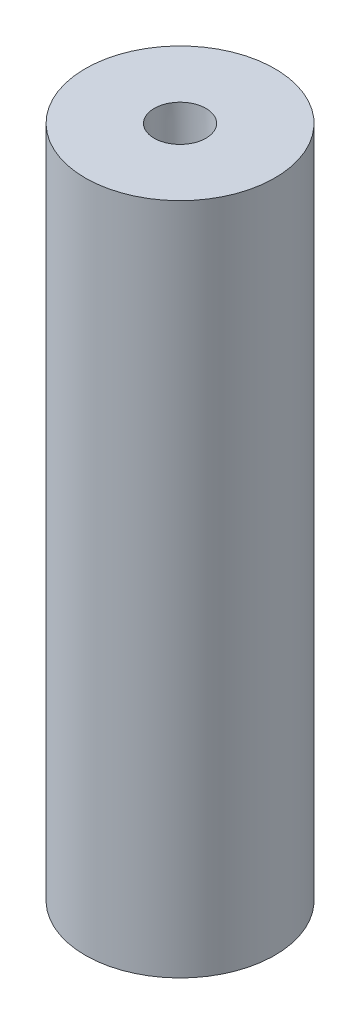
from build123d import *

# Parameters (mm, degrees)
SKETCH1_R           = 9.15
BOSS_EXTRUDE1_DEPTH = 65
SKETCH2_R           = 2.5
CUT_EXTRUDE1_DEPTH  = 10
CHAMFER1_SIZE2      = 0.25
CHAMFER1_SIZE       = 10
CUT_EXTRUDE2_START  = -10
SKETCH3_R           = 2.5
CUT_EXTRUDE2_DEPTH  = 10
CHAMFER2_SIZE2      = 0.25
CHAMFER2_SIZE       = 10


with BuildPart() as part:
    # Sketch1 → Boss-Extrude1 (new body)
    with BuildSketch(Plane(origin=(0, 0, 0), x_dir=(1, 0, 0), z_dir=(0, 1, 0))):
        with Locations(Location((0, 0, 0), (0, 0, 270))):
            Circle(SKETCH1_R)
    extrude(amount=BOSS_EXTRUDE1_DEPTH)

    # Sketch2 → Cut-Extrude1 (cut)
    with BuildSketch(Plane(origin=(0, 65, 0), x_dir=(1, 0, 0), z_dir=(0, 1, 0))):
        with Locations(Location((0, 0, 0), (0, 0, 270))):
            Circle(SKETCH2_R)
    extrude(amount=-CUT_EXTRUDE1_DEPTH, mode=Mode.SUBTRACT)

    # Chamfer1
    chamfer1_edges = [part.edges().sort_by_distance(p)[0] for p in [
        (0, 55, -2.5),
    ]]
    chamfer1_side = [part.faces().sort_by_distance(p)[0] for p in [
        (0, 55.005, -2.5),
    ]]
    chamfer(chamfer1_edges, length=CHAMFER1_SIZE - 0.0001, length2=CHAMFER1_SIZE2 - 0.0001, reference=chamfer1_side[0])  # a hair under: the kernel refuses the full size

    # Sketch3 → Cut-Extrude2 (cut)
    with BuildSketch(Plane.XZ.offset(CUT_EXTRUDE2_START)):
        with Locations(Location((0, 0, 0), (0, 0, 270))):
            Circle(SKETCH3_R)
    extrude(amount=CUT_EXTRUDE2_DEPTH, mode=Mode.SUBTRACT)

    # Chamfer2
    chamfer2_edges = [part.edges().sort_by_distance(p)[0] for p in [
        (0, 10, 2.5),
    ]]
    chamfer2_side = [part.faces().sort_by_distance(p)[0] for p in [
        (0, 9.995, 2.5),
    ]]
    chamfer(chamfer2_edges, length=CHAMFER2_SIZE - 0.0001, length2=CHAMFER2_SIZE2 - 0.0001, reference=chamfer2_side[0])  # a hair under: the kernel refuses the full size


solid = part.part
